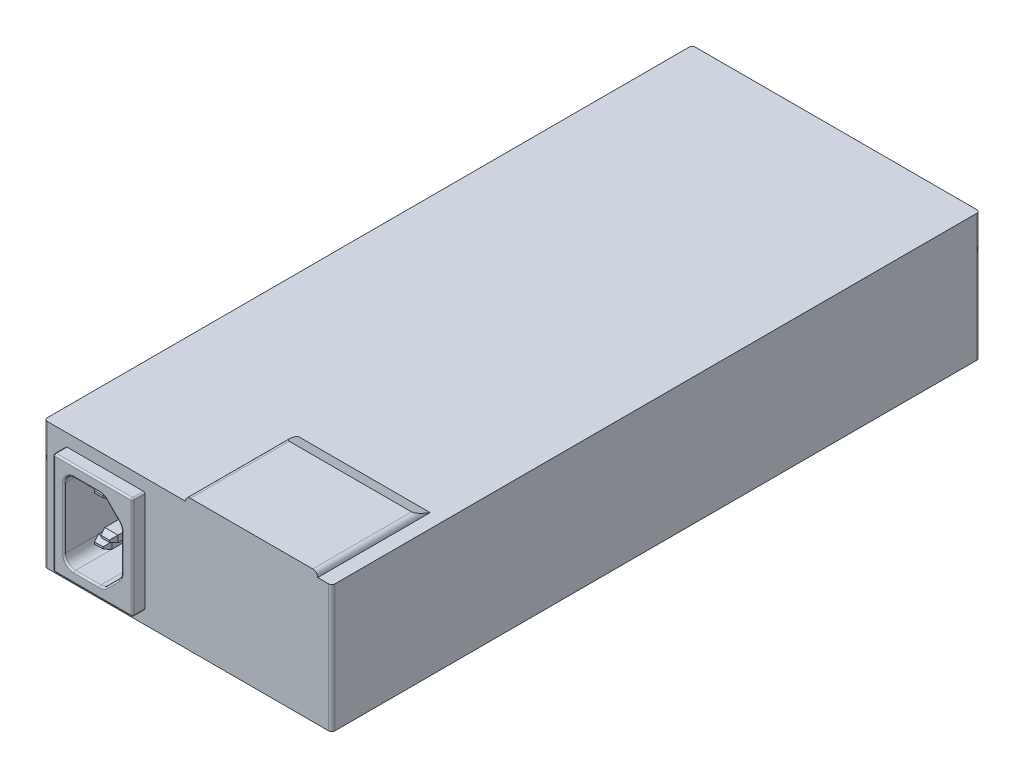
from build123d import *
from OCP.BRepFilletAPI import BRepFilletAPI_MakeChamfer

# Parameters (mm, degrees)
BOSS_EXTRUDE1_DEPTH = 34
SKETCH2_W           = 87
SKETCH2_H           = 38.5
BOSS_EXTRUDE2_DEPTH = 162
SKETCH3_W           = 65.25
SKETCH3_H           = 1.65
BOSS_EXTRUDE3_DEPTH = 8.86
FILLET1_R           = 1
CHAMFER1_SIZE2      = 1.5
CHAMFER1_SIZE       = 4.121216129
FILLET2_R           = 1.5
SKETCH4_W           = 24
SKETCH4_H           = 31
BOSS_EXTRUDE4_DEPTH = 3.75
CUT_EXTRUDE1_DEPTH  = 16.75
SKETCH6_W           = 4
SKETCH6_H           = 2
BOSS_EXTRUDE5_DEPTH = 11.75
SKETCH7_W           = 4
SKETCH7_H           = 2
BOSS_EXTRUDE6_DEPTH = 15.75
CHAMFER2_SIZE       = 0.7
CHAMFER2_SIZE2      = 1.923234194
FILLET3_R           = 0.5


with BuildPart() as part:
    # Sketch1 → Boss-Extrude1 (new body)
    with BuildSketch(Plane.XY):
        Polygon((42.75, 40), (82.75, 40), (82.75, 38.5), (87, 38.5), (87, 0), (0, 0), (0, 38.5), (42.75, 38.5), align=None)
    extrude(amount=-BOSS_EXTRUDE1_DEPTH)

    # Sketch2 → Boss-Extrude2 (add)
    with BuildSketch(Plane(origin=(0, 0, -34), x_dir=(-1, 0, 0), z_dir=(0, 0, -1))):
        with Locations((-43.5, 19.25)):
            Rectangle(SKETCH2_W, SKETCH2_H)
    extrude(amount=BOSS_EXTRUDE2_DEPTH)

    # Sketch3 → Boss-Extrude3 (add)
    with BuildSketch(Plane(origin=(0, 0, -196), x_dir=(-1, 0, 0), z_dir=(0, 0, -1))):
        with Locations((-42.375, 5.175)):
            Rectangle(SKETCH3_W, SKETCH3_H)
    extrude(amount=BOSS_EXTRUDE3_DEPTH)

    # Fillet1
    fillet1_edges = [part.edges().sort_by_distance(p)[0] for p in [
        (87, 19.25, 0),
        (0, 19.25, 0),
        (0, 19.25, -196),
        (87, 19.25, -196),
    ]]
    fillet(fillet1_edges, radius=FILLET1_R)

    # Chamfer1
    chamfer1_edges = [part.edges().sort_by_distance(p)[0] for p in [
        (62.75, 40, -34),
    ]]
    chamfer1_side = [part.faces().sort_by_distance(p)[0] for p in [
        (62.75, 40, -33.97),
    ]]
    chamfer(chamfer1_edges, length=CHAMFER1_SIZE - 0.0001, length2=CHAMFER1_SIZE2 - 0.0001, reference=chamfer1_side[0])  # a hair under: the kernel refuses the full size

    # Fillet2
    fillet2_edges = [part.edges().sort_by_distance(p)[0] for p in [
        (42.75, 40, -14.939441935),
        (82.75, 40, -14.939441935),
    ]]
    fillet(fillet2_edges, radius=FILLET2_R - 0.0001)  # a hair under: the kernel refuses the full size

    # Sketch4 → Boss-Extrude4 (add)
    with BuildSketch(Plane.XY):
        with Locations((18.5, 19.25)):
            Rectangle(SKETCH4_W, SKETCH4_H)
    extrude(amount=BOSS_EXTRUDE4_DEPTH)

    # Sketch5 → Cut-Extrude1 (cut)
    with BuildSketch(Plane.XY.offset(3.75)):
        with BuildLine():
            Line((27.2, 13.792640687), (27.2, 24.707359313))
            ThreePointArc((27.2, 24.707359313), (26.971638598, 25.85540961), (26.321320344, 26.828679656))
            Line((26.321320344, 26.828679656), (22.578679656, 30.571320344))
            ThreePointArc((22.578679656, 30.571320344), (21.60540961, 31.221638598), (20.457359313, 31.45))
            Line((20.457359313, 31.45), (12.8, 31.45))
            ThreePointArc((12.8, 31.45), (10.678679656, 30.571320344), (9.8, 28.45))
            Line((9.8, 28.45), (9.8, 10.05))
            ThreePointArc((9.8, 10.05), (10.678679656, 7.928679656), (12.8, 7.05))
            Line((12.8, 7.05), (20.457359313, 7.05))
            ThreePointArc((20.457359313, 7.05), (21.60540961, 7.278361402), (22.578679656, 7.928679656))
            Line((22.578679656, 7.928679656), (26.321320344, 11.671320344))
            ThreePointArc((26.321320344, 11.671320344), (26.971638598, 12.64459039), (27.2, 13.792640687))
        make_face()
    extrude(amount=-CUT_EXTRUDE1_DEPTH, mode=Mode.SUBTRACT)

    # Sketch6 → Boss-Extrude5 (add)
    with BuildSketch(Plane.XY.offset(-13)):
        with Locations((15.3, 25.95)):
            Rectangle(SKETCH6_W, SKETCH6_H)
        with Locations((15.3, 12.55)):
            Rectangle(SKETCH6_W, SKETCH6_H)
    extrude(amount=BOSS_EXTRUDE5_DEPTH)

    # Sketch7 → Boss-Extrude6 (add)
    with BuildSketch(Plane.XY.offset(-13)):
        with Locations((21.2, 19.25)):
            Rectangle(SKETCH7_W, SKETCH7_H)
    extrude(amount=BOSS_EXTRUDE6_DEPTH)

    # Chamfer2: one chamfer whose edges measure the first distance from different faces: ONE call of the kernel's chamfer builder (chamfer() names one face for all edges)
    chamfer2_edges_1 = [part.edges().sort_by_distance(p)[0] for p in [
        (17.3, 25.95, -1.25),
        (15.3, 26.95, -1.25),
        (13.3, 25.95, -1.25),
        (15.3, 24.95, -1.25),
    ]]
    chamfer2_side_1 = [part.faces().sort_by_distance(p)[0] for p in [
        (15.3, 25.95, -1.25),
    ]]
    chamfer2_edges_2 = [part.edges().sort_by_distance(p)[0] for p in [
        (17.3, 12.55, -1.25),
        (15.3, 13.55, -1.25),
        (13.3, 12.55, -1.25),
        (15.3, 11.55, -1.25),
    ]]
    chamfer2_side_2 = [part.faces().sort_by_distance(p)[0] for p in [
        (15.3, 12.55, -1.25),
    ]]
    chamfer2_edges_3 = [part.edges().sort_by_distance(p)[0] for p in [
        (21.2, 18.25, 2.75),
        (23.2, 19.25, 2.75),
        (21.2, 20.25, 2.75),
        (19.2, 19.25, 2.75),
    ]]
    chamfer2_side_3 = [part.faces().sort_by_distance(p)[0] for p in [
        (21.2, 19.25, 2.75),
    ]]
    chamfer2 = BRepFilletAPI_MakeChamfer(part.part.solid().wrapped)
    for e in chamfer2_edges_1:
        chamfer2.Add(CHAMFER2_SIZE, CHAMFER2_SIZE2, e.wrapped, chamfer2_side_1[0].wrapped)  # the first distance lies on this face
    for e in chamfer2_edges_2:
        chamfer2.Add(CHAMFER2_SIZE, CHAMFER2_SIZE2, e.wrapped, chamfer2_side_2[0].wrapped)  # the first distance lies on this face
    for e in chamfer2_edges_3:
        chamfer2.Add(CHAMFER2_SIZE, CHAMFER2_SIZE2, e.wrapped, chamfer2_side_3[0].wrapped)  # the first distance lies on this face
    add(Compound.cast(chamfer2.Shape()), mode=Mode.REPLACE)

    # Fillet3
    fillet3_edges = [part.edges().sort_by_distance(p)[0] for p in [
        (30.5, 3.75, 1.875),
        (30.5, 34.75, 1.875),
        (6.5, 34.75, 1.875),
        (6.5, 3.75, 1.875),
        (30.5, 19.25, 3.75),
        (18.5, 34.75, 3.75),
        (6.5, 19.25, 3.75),
        (18.5, 3.75, 3.75),
        (10.678679656, 7.928679656, 3.75),
        (16.628679656, 7.05, 3.75),
        (21.60540961, 7.278361402, 3.75),
        (24.45, 9.8, 3.75),
        (26.971638598, 12.64459039, 3.75),
        (27.2, 19.25, 3.75),
        (26.971638598, 25.85540961, 3.75),
        (24.45, 28.7, 3.75),
        (21.60540961, 31.221638598, 3.75),
        (16.628679656, 31.45, 3.75),
        (10.678679656, 30.571320344, 3.75),
        (9.8, 19.25, 3.75),
    ]]
    fillet(fillet3_edges, radius=FILLET3_R)


solid = part.part
